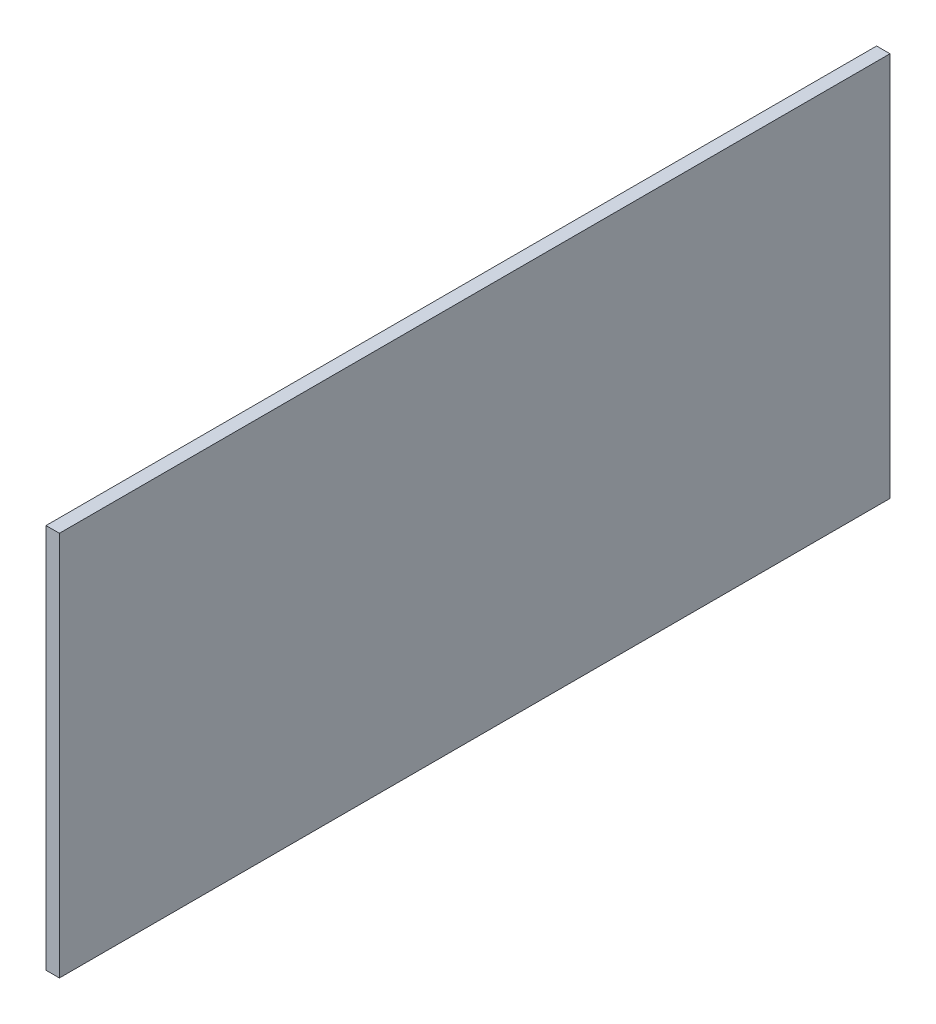
from build123d import *

# Parameters (mm, degrees)
SKETCH1_W           = 99.2004
SKETCH1_H           = 46
BOSS_EXTRUDE1_DEPTH = 1.6002


with BuildPart() as part:
    # Sketch1 → Boss-Extrude1 (new body)
    with BuildSketch(Plane(origin=(0, 0, 0), x_dir=(0, 0, -1), z_dir=(1, 0, 0))):
        with Locations((49.6002, 23)):
            Rectangle(SKETCH1_W, SKETCH1_H)
    extrude(amount=BOSS_EXTRUDE1_DEPTH)


solid = part.part
